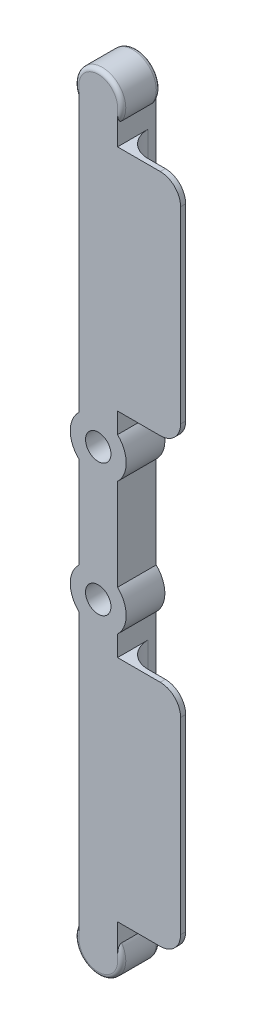
from build123d import *

# Parameters (mm, degrees)
SKETCH1_R            = 2.5
BOSS_EXTRUDE1_DEPTH  = 7.6
SKETCH4_W            = 20
SKETCH4_H            = 45
BOSS_EXTRUDE2_DEPTH  = 1
FILLET3_R            = 0.8
FILLET2_R            = 4
FILLET1_R            = 5
FILLET3_OF_MIRROR1_R = 0.8
FILLET2_OF_MIRROR1_R = 4
FILLET1_OF_MIRROR1_R = 5


with BuildPart() as part:
    # Sketch1 → Boss-Extrude1 (new body)
    with BuildSketch(Plane.XY):
        with BuildLine():
            Line((3.8, -47.02382093), (3.8, 6))
            ThreePointArc((3.8, 6), (0, 13.252645761), (-3.8, 6))
            Line((-3.8, 6), (-3.8, -47.02382093))
            ThreePointArc((-3.8, -47.02382093), (-5.5, -51), (-3.8, -54.97617907))
            Line((-3.8, -54.97617907), (-3.8, -64))
            Line((-3.8, -64), (3.8, -64))
            Line((3.8, -64), (3.8, -54.97617907))
            ThreePointArc((3.8, -54.97617907), (5.5, -51), (3.8, -47.02382093))
        make_face()
        with Locations((0, -51)):
            Circle(SKETCH1_R, mode=Mode.SUBTRACT)
    boss_extrude1 = extrude(amount=BOSS_EXTRUDE1_DEPTH)

    # Sketch4 → Boss-Extrude2 (add)
    with BuildSketch(Plane.XY.offset(7.6)):
        with Locations((6.2, -20.5)):
            Rectangle(SKETCH4_W, SKETCH4_H)
    boss_extrude2 = extrude(amount=-BOSS_EXTRUDE2_DEPTH)

    # Fillet3
    fillet3_edges = [part.edges().sort_by_distance(p)[0] for p in [
        (0, 13.252645761, 0),
        (0, 13.252645761, 7.6),
    ]]
    fillet(fillet3_edges, radius=FILLET3_R)

    # Fillet2
    fillet2_edges = [part.edges().sort_by_distance(p)[0] for p in [
        (16.2, 2, 7.1),
        (16.2, -43, 7.1),
    ]]
    fillet(fillet2_edges, radius=FILLET2_R)

    # Fillet1
    fillet1_edges = [part.edges().sort_by_distance(p)[0] for p in [
        (3.8, -20.5, 6.6),
    ]]
    fillet(fillet1_edges, radius=FILLET1_R)

    # Mirror1: Boss-Extrude1, Boss-Extrude2 across plane
    add(boss_extrude1.mirror(Plane(origin=(0, -64, 0), x_dir=(0, 0, 1), z_dir=(0, -1, 0))))
    add(boss_extrude2.mirror(Plane(origin=(0, -64, 0), x_dir=(0, 0, 1), z_dir=(0, -1, 0))))

    # Fillet3 of Mirror1
    fillet3_of_mirror1_edges = [part.edges().sort_by_distance(p)[0] for p in [
        (0, -141.252645761, 0),
        (0, -141.252645761, 7.6),
    ]]
    fillet(fillet3_of_mirror1_edges, radius=FILLET3_OF_MIRROR1_R)

    # Fillet2 of Mirror1
    fillet2_of_mirror1_edges = [part.edges().sort_by_distance(p)[0] for p in [
        (16.2, -130, 7.1),
        (16.2, -85, 7.1),
    ]]
    fillet(fillet2_of_mirror1_edges, radius=FILLET2_OF_MIRROR1_R)

    # Fillet1 of Mirror1
    fillet1_of_mirror1_edges = [part.edges().sort_by_distance(p)[0] for p in [
        (3.8, -107.5, 6.6),
    ]]
    fillet(fillet1_of_mirror1_edges, radius=FILLET1_OF_MIRROR1_R)


solid = part.part
